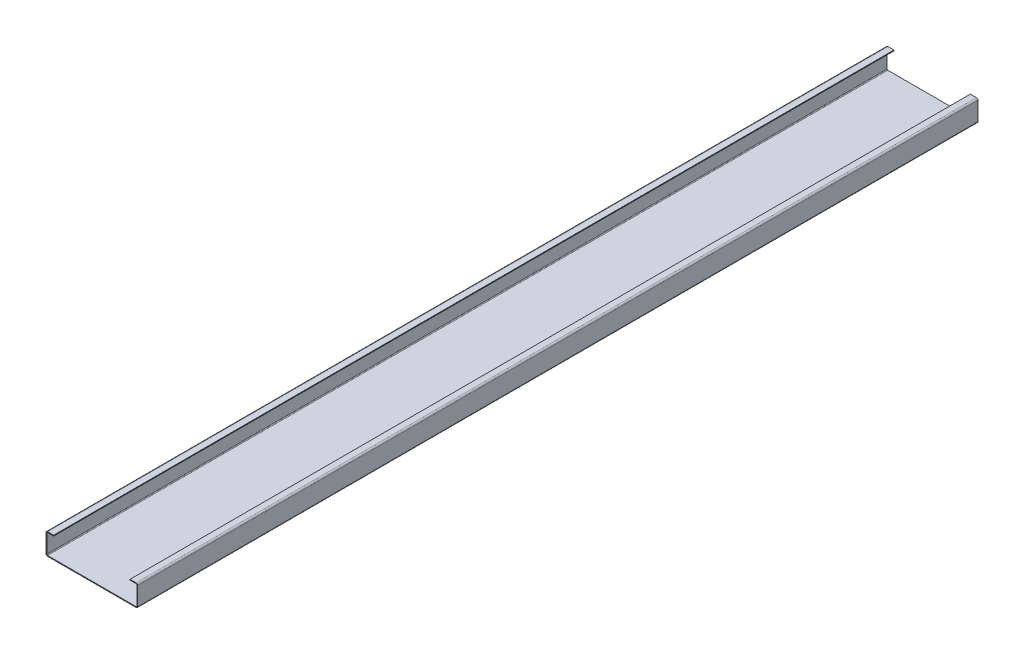
from build123d import *

# Parameters (mm, degrees)
TABAN_FLAN_1_DEPTH = 5500


# Sheet-metal steps are written as plain solids
with BuildPart() as part:
    # Çizim1 → Taban-Flanş1 (new body)
    with BuildSketch(Plane.XY):
        with BuildLine():
            Line((0, 0), (-40, 0))
            ThreePointArc((-40, 0), (-47.071067812, -2.928932188), (-50, -10))
            Line((-50, -10), (-50, -130))
            ThreePointArc((-50, -130), (-47.071067812, -137.071067812), (-40, -140))
            Line((-40, -140), (540, -140))
            ThreePointArc((540, -140), (547.071067812, -137.071067812), (550, -130))
            Line((550, -130), (550, -10))
            ThreePointArc((550, -10), (547.071067812, -2.928932188), (540, 0))
            Line((540, 0), (500, 0))
            Line((500, 0), (500, -5))
            Line((500, -5), (540, -5))
            ThreePointArc((540, -5), (543.535533906, -6.464466094), (545, -10))
            Line((545, -10), (545, -130))
            ThreePointArc((545, -130), (543.535533906, -133.535533906), (540, -135))
            Line((540, -135), (-40, -135))
            ThreePointArc((-40, -135), (-43.535533906, -133.535533906), (-45, -130))
            Line((-45, -130), (-45, -10))
            ThreePointArc((-45, -10), (-43.535533906, -6.464466094), (-40, -5))
            Line((-40, -5), (0, -5))
            Line((0, -5), (0, 0))
        make_face()
    extrude(amount=TABAN_FLAN_1_DEPTH)


solid = part.part
